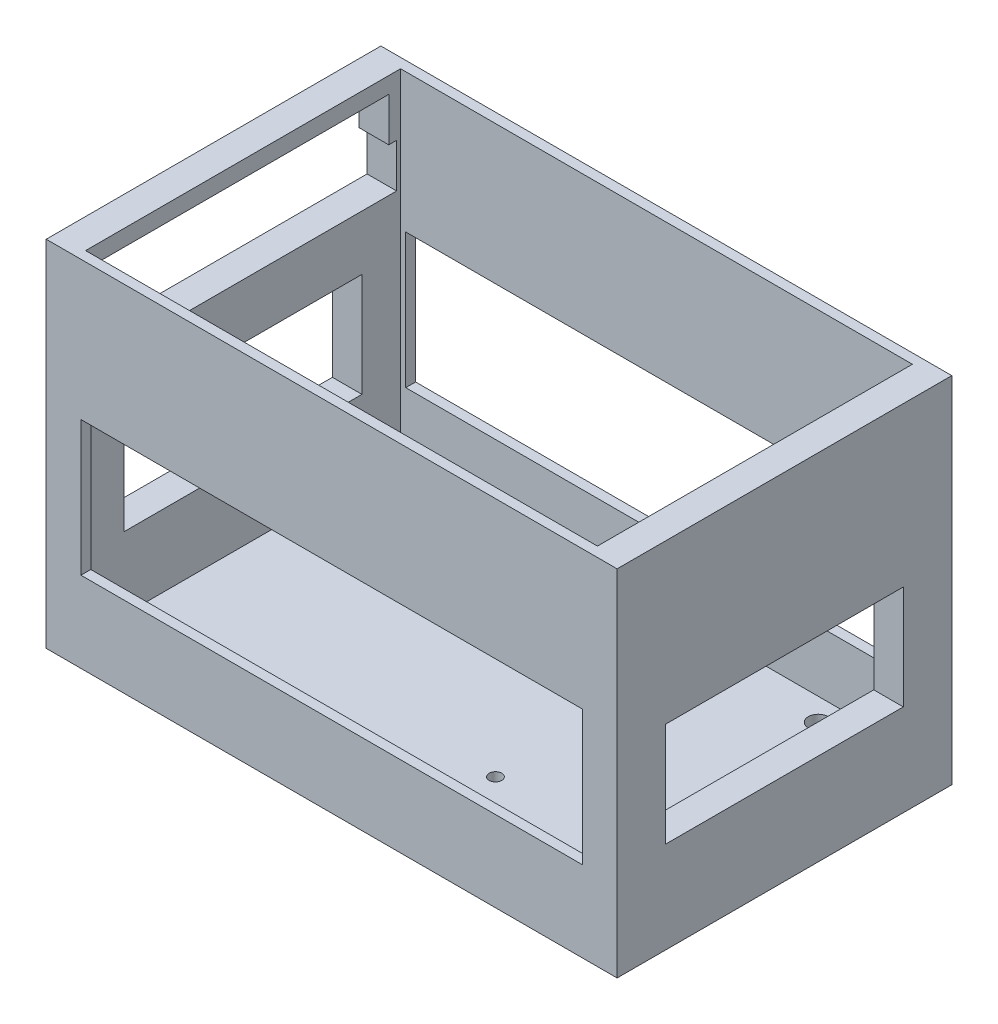
from build123d import *

# Parameters (mm, degrees)
SKETCH1_W           = 145
SKETCH1_H           = 85
BOSS_EXTRUDE1_DEPTH = 90
SKETCH3_W           = 130
SKETCH3_H           = 80
CUT_EXTRUDE1_DEPTH  = 85
SKETCH8_R           = 1.7
CUT_EXTRUDE2_DEPTH  = 10
SKETCH9_R           = 1.6
CUT_EXTRUDE3_DEPTH  = 10
SKETCH10_W          = 60.36577322
SKETCH10_H          = 26.383642142
CUT_EXTRUDE4_DEPTH  = 176.87282337
SKETCH11_W          = 127.368574342
SKETCH11_H          = 34.248868694
CUT_EXTRUDE5_DEPTH  = 144.461667354
CUT_EXTRUDE8_DEPTH  = 142
SKETCH13_R          = 2.5
CUT_EXTRUDE9_DEPTH  = 10
FILLET1_R           = 5


with BuildPart() as part:
    # Sketch1 → Boss-Extrude1 (new body)
    with BuildSketch(Plane(origin=(0, 0, 0), x_dir=(1, 0, 0), z_dir=(0, 1, 0))):
        Rectangle(SKETCH1_W, SKETCH1_H)
    extrude(amount=BOSS_EXTRUDE1_DEPTH)

    # Sketch3 → Cut-Extrude1 (cut)
    with BuildSketch(Plane(origin=(0, 90, 0), x_dir=(1, 0, 0), z_dir=(0, 1, 0))):
        Rectangle(SKETCH3_W, SKETCH3_H)
    extrude(amount=-CUT_EXTRUDE1_DEPTH, mode=Mode.SUBTRACT)

    # Sketch8 → Cut-Extrude2 (cut)
    with BuildSketch(Plane(origin=(0, 5, 0), x_dir=(1, 0, 0), z_dir=(0, 1, 0))):
        with Locations(Location((-59.631593059, 20.42, 0), (0, 0, 270))):
            Circle(SKETCH8_R)
        with Locations(Location((-11.231593059, 18.71, 0), (0, 0, 270))):
            Circle(SKETCH8_R)
        with Locations(Location((-54.631593059, -32.1, 0), (0, 0, 270))):
            Circle(SKETCH8_R)
        with Locations(Location((-26.671593059, -32.1, 0), (0, 0, 270))):
            Circle(SKETCH8_R)
    extrude(amount=-CUT_EXTRUDE2_DEPTH, mode=Mode.SUBTRACT)

    # Sketch9 → Cut-Extrude3 (cut)
    with BuildSketch(Plane(origin=(0, 5, 0), x_dir=(1, 0, 0), z_dir=(0, 1, 0))):
        with Locations(Location((57.802096986, 21.3, 0), (0, 0, 270))):
            Circle(SKETCH9_R)
        with Locations(Location((17.802096986, 21.3, 0), (0, 0, 270))):
            Circle(SKETCH9_R)
        with Locations(Location((17.802096986, -18.7, 0), (0, 0, 270))):
            Circle(SKETCH9_R)
        with Locations(Location((57.802096986, -18.7, 0), (0, 0, 270))):
            Circle(SKETCH9_R)
    extrude(amount=-CUT_EXTRUDE3_DEPTH, mode=Mode.SUBTRACT)

    # Sketch10 → Cut-Extrude4 (cut, through all)
    with BuildSketch(Plane(origin=(72.5, 0, 0), x_dir=(0, 0, -1), z_dir=(1, 0, 0))):
        with Locations((0, 36.47748396)):
            Rectangle(SKETCH10_W, SKETCH10_H)
    extrude(amount=-CUT_EXTRUDE4_DEPTH, mode=Mode.SUBTRACT)

    # Sketch11 → Cut-Extrude5 (cut, through all)
    with BuildSketch(Plane(origin=(0, 0, -42.5), x_dir=(-1, 0, 0), z_dir=(0, 0, -1))):
        with Locations((0, 37.630477743)):
            Rectangle(SKETCH11_W, SKETCH11_H)
    extrude(amount=-CUT_EXTRUDE5_DEPTH, mode=Mode.SUBTRACT)

    # Sketch12 → Cut-Extrude8 (cut)
    with BuildSketch(Plane.ZY.offset(72.5)):
        Polygon((-39, 63.608903916), (39, 63.608903916), (39, 74.758903916), (37, 74.758903916), (37, 85.858903916), (-37, 85.858903916), (-37, 74.758903916), (-39, 74.758903916), align=None)
    extrude(amount=-CUT_EXTRUDE8_DEPTH, mode=Mode.SUBTRACT)

    # Sketch13 → Cut-Extrude9 (cut)
    with BuildSketch(Plane.XZ):
        with Locations(Location((46.785911221, -34.286332812, 0), (0, 0, 270))):
            Circle(SKETCH13_R)
        with Locations(Location((0, -34.286332812, 0), (0, 0, 270))):
            Circle(SKETCH13_R)
    extrude(amount=-CUT_EXTRUDE9_DEPTH, mode=Mode.SUBTRACT)

    # Fillet1
    # the kernel refuses this fillet: 5 mm, written as the material it adds along each edge
    with BuildSketch(Plane(origin=(69.5, 87.19624688, -39), x_dir=(-1, 0, 0), z_dir=(0, -1, 0)), Plane(origin=(69.5, 51.171560952, 39), x_dir=(-1, 0, 0), z_dir=(0, 1, 0))) as fillet1_piece_1:
        with BuildLine():
            CenterArc((5, -4.974937186), FILLET1_R, 95.739170477, 84.260829523)
            Line((0, -4.974937186), (-0.1, -4.974937186))
            Line((-0.1, -4.974937186), (-0.1, 0))
            Line((-0.1, 0), (0, 0.1))
            ThreePointArc((0, 0.1), (2.25, 0.1), (4.49, 0.099498744))
            Line((4.49, 0.099498744), (4.5, 0))
        make_face()
    extrude(amount=36.024685928)


solid = part.part
